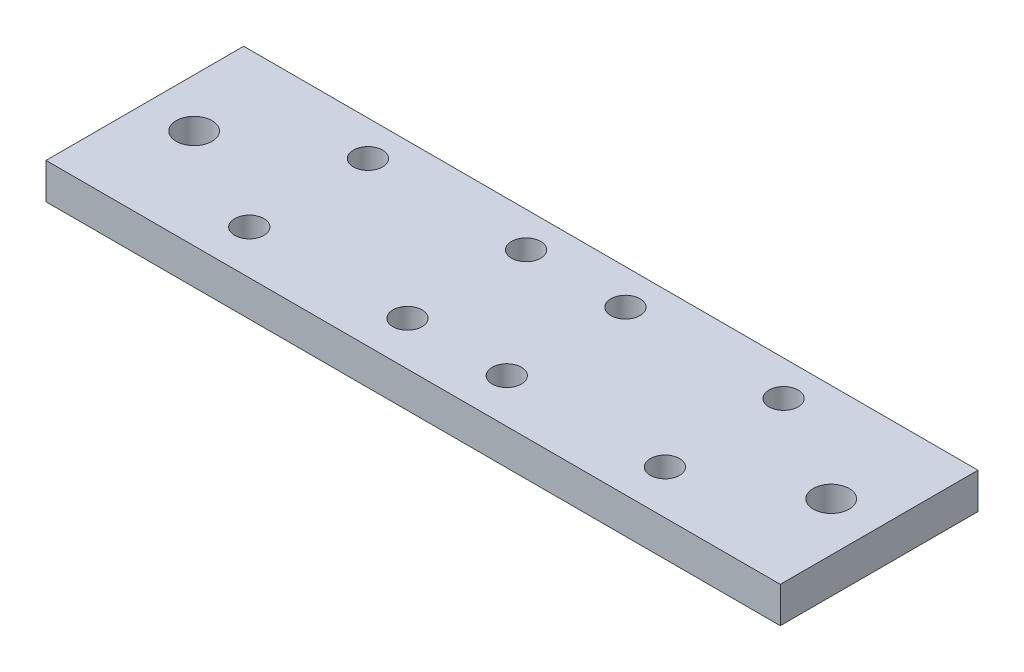
from build123d import *

# Parameters (mm, degrees)
SKETCH1_W           = 130
SKETCH1_H           = 35
BOSS_EXTRUDE1_DEPTH = 6.35
SKETCH5_R           = 3.18
CUT_EXTRUDE2_DEPTH  = 135.778790987
SKETCH8_R           = 2.58660254
CUT_EXTRUDE4_DEPTH  = 135.778790987


with BuildPart() as part:
    # Sketch1 → Boss-Extrude1 (new body)
    with BuildSketch(Plane(origin=(0, 0, 0), x_dir=(1, 0, 0), z_dir=(0, 1, 0))):
        with Locations((65, -17.5)):
            Rectangle(SKETCH1_W, SKETCH1_H)
    extrude(amount=BOSS_EXTRUDE1_DEPTH)

    # Sketch5 → Cut-Extrude2 (cut, through all)
    with BuildSketch(Plane(origin=(0, 6.35, 0), x_dir=(1, 0, 0), z_dir=(0, 1, 0))):
        with Locations((8.605, -17.382603272)):
            Circle(SKETCH5_R)
        with Locations((121.395, -17.382603272)):
            Circle(SKETCH5_R)
    extrude(amount=-CUT_EXTRUDE2_DEPTH, mode=Mode.SUBTRACT)

    # Sketch8 → Cut-Extrude4 (cut, through all)
    with BuildSketch(Plane.XZ):
        with Locations((28.210120746, 6.213806455)):
            Circle(SKETCH8_R)
        with Locations((28.210120746, 27.213806455)):
            Circle(SKETCH8_R)
        with Locations((56.210120746, 27.213806455)):
            Circle(SKETCH8_R)
        with Locations((56.210120746, 6.213806455)):
            Circle(SKETCH8_R)
        with Locations((73.792072874, 6.213806455)):
            Circle(SKETCH8_R)
        with Locations((73.792072874, 27.213806455)):
            Circle(SKETCH8_R)
        with Locations((101.792072874, 6.213806455)):
            Circle(SKETCH8_R)
        with Locations((101.792072874, 27.213806455)):
            Circle(SKETCH8_R)
    extrude(amount=-CUT_EXTRUDE4_DEPTH, mode=Mode.SUBTRACT)


solid = part.part
